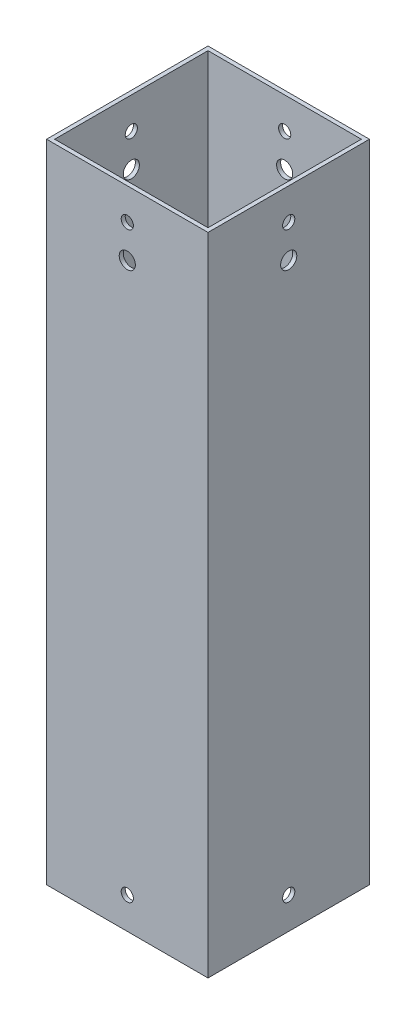
from build123d import *

# Parameters (mm, degrees)
SKETCH1_W               = 63.5
SKETCH1_H               = 63.5
SKETCH1_W_2             = 60.325
SKETCH1_H_2             = 60.325
BOSS_EXTRUDE1_DEPTH     = 254
SKETCH3_W               = 60.325
SKETCH3_H               = 60.325
BOSS_EXTRUDE3_DEPTH     = 2.54
CUT_EXTRUDE1_DEPTH      = 264.357589897
CUT_EXTRUDE1_DEPTH_BACK = 264.357589897
SKETCH4_R               = 2.3999952
SKETCH5_R               = 2.3999952
CUT_EXTRUDE2_DEPTH      = 264.735307648
CUT_EXTRUDE3_DEPTH      = 264.735307648
CUT_EXTRUDE3_DEPTH_BACK = 264.735307648
SKETCH6_R               = 2.3999952
CUT_EXTRUDE4_DEPTH      = 264.735307648
CUT_EXTRUDE4_DEPTH_BACK = 264.735307648
SKETCH7_R               = 2.3999952
CUT_EXTRUDE5_DEPTH      = 264.735307648
CUT_EXTRUDE5_DEPTH_BACK = 264.735307648
SKETCH8_R               = 3.175
CUT_EXTRUDE6_DEPTH      = 264.735307648
CUT_EXTRUDE6_DEPTH_BACK = 264.735307648
SKETCH9_R               = 3.175


with BuildPart() as part:
    # Sketch1 → Boss-Extrude1 (new body)
    with BuildSketch(Plane(origin=(0, 0, 0), x_dir=(1, 0, 0), z_dir=(0, 1, 0))):
        Rectangle(SKETCH1_W, SKETCH1_H)
        Rectangle(SKETCH1_W_2, SKETCH1_H_2, mode=Mode.SUBTRACT)
    extrude(amount=BOSS_EXTRUDE1_DEPTH)

    # Sketch3 → Boss-Extrude3 (add)
    with BuildSketch(Plane(origin=(0, 152.4, 0), x_dir=(1, 0, 0), z_dir=(0, 1, 0))):
        Rectangle(SKETCH3_W, SKETCH3_H)
    extrude(amount=-BOSS_EXTRUDE3_DEPTH)

    # Sketch4 → Cut-Extrude1 (cut, two sides: drawn at the far end of the back side and taken through both)
    with BuildSketch(Plane(origin=(-30.1625, 0, 0), x_dir=(0, 0, -1), z_dir=(1, 0, 0)).offset(-CUT_EXTRUDE1_DEPTH_BACK)):
        with Locations((0, 241.587599882)):
            Circle(SKETCH4_R)
    extrude(amount=CUT_EXTRUDE1_DEPTH + CUT_EXTRUDE1_DEPTH_BACK, mode=Mode.SUBTRACT)

    # Sketch5 → Cut-Extrude2 (cut, through all)
    with BuildSketch(Plane(origin=(0, 0, -31.75), x_dir=(-1, 0, 0), z_dir=(0, 0, -1))):
        with Locations((0, 241.587599882)):
            Circle(SKETCH5_R)
    extrude(amount=-CUT_EXTRUDE2_DEPTH, mode=Mode.SUBTRACT)

    # Sketch6 → Cut-Extrude3 (cut, two sides: drawn at the far end of the back side and taken through both)
    with BuildSketch(Plane(origin=(31.75, 0, 0), x_dir=(0, 0, -1), z_dir=(1, 0, 0)).offset(-CUT_EXTRUDE3_DEPTH_BACK)):
        with Locations((0, 12.412400118)):
            Circle(SKETCH6_R)
    extrude(amount=CUT_EXTRUDE3_DEPTH + CUT_EXTRUDE3_DEPTH_BACK, mode=Mode.SUBTRACT)

    # Sketch7 → Cut-Extrude4 (cut, two sides: drawn at the far end of the back side and taken through both)
    with BuildSketch(Plane(origin=(0, 0, -31.75), x_dir=(-1, 0, 0), z_dir=(0, 0, -1)).offset(-CUT_EXTRUDE4_DEPTH_BACK)):
        with Locations((0, 12.412400118)):
            Circle(SKETCH7_R)
    extrude(amount=CUT_EXTRUDE4_DEPTH + CUT_EXTRUDE4_DEPTH_BACK, mode=Mode.SUBTRACT)

    # Sketch8 → Cut-Extrude5 (cut, two sides: drawn at the far end of the back side and taken through both)
    with BuildSketch(Plane(origin=(0, 0, -31.75), x_dir=(-1, 0, 0), z_dir=(0, 0, -1)).offset(-CUT_EXTRUDE5_DEPTH_BACK)):
        with Locations((0, 228.6)):
            Circle(SKETCH8_R)
    extrude(amount=CUT_EXTRUDE5_DEPTH + CUT_EXTRUDE5_DEPTH_BACK, mode=Mode.SUBTRACT)

    # Sketch9 → Cut-Extrude6 (cut, two sides: drawn at the far end of the back side and taken through both)
    with BuildSketch(Plane(origin=(31.75, 0, 0), x_dir=(0, 0, -1), z_dir=(1, 0, 0)).offset(-CUT_EXTRUDE6_DEPTH_BACK)):
        with Locations((0, 228.6)):
            Circle(SKETCH9_R)
    extrude(amount=CUT_EXTRUDE6_DEPTH + CUT_EXTRUDE6_DEPTH_BACK, mode=Mode.SUBTRACT)


solid = part.part
